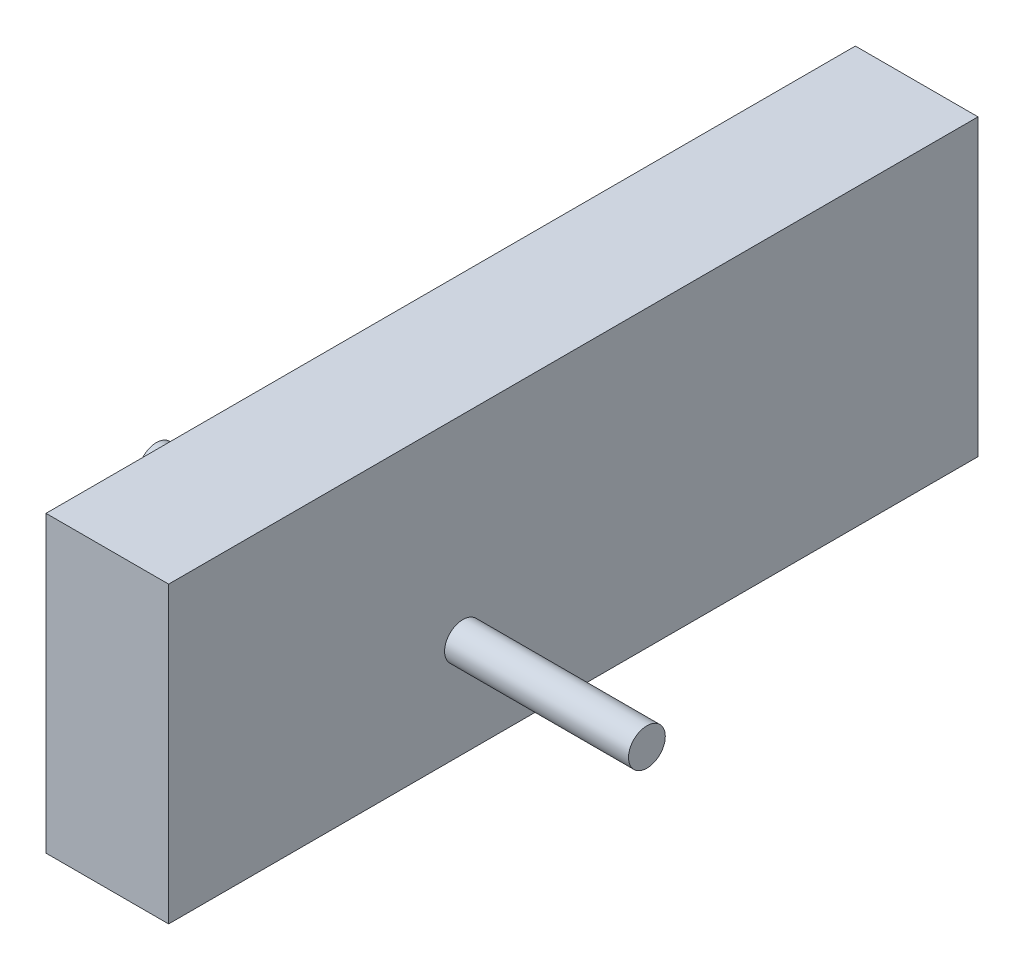
from build123d import *

# Parameters (mm, degrees)
SKETCH1_R           = 9.525
BOSS_EXTRUDE1_DEPTH = 127
SKETCH2_W           = 419.1
SKETCH2_H           = 152.4
BOSS_EXTRUDE2_DEPTH = 31.75


with BuildPart() as part:
    # Sketch1 → Boss-Extrude1 (new, symmetric)
    with BuildSketch(Plane(origin=(0, 0, 0), x_dir=(0, 0, -1), z_dir=(1, 0, 0))):
        Circle(SKETCH1_R)
    extrude(amount=BOSS_EXTRUDE1_DEPTH, both=True)

    # Sketch2 → Boss-Extrude2 (add, symmetric)
    with BuildSketch(Plane(origin=(0, 0, 0), x_dir=(0, 0, -1), z_dir=(1, 0, 0))):
        with Locations((57.15, 25.4)):
            Rectangle(SKETCH2_W, SKETCH2_H)
    extrude(amount=BOSS_EXTRUDE2_DEPTH, both=True)


solid = part.part
